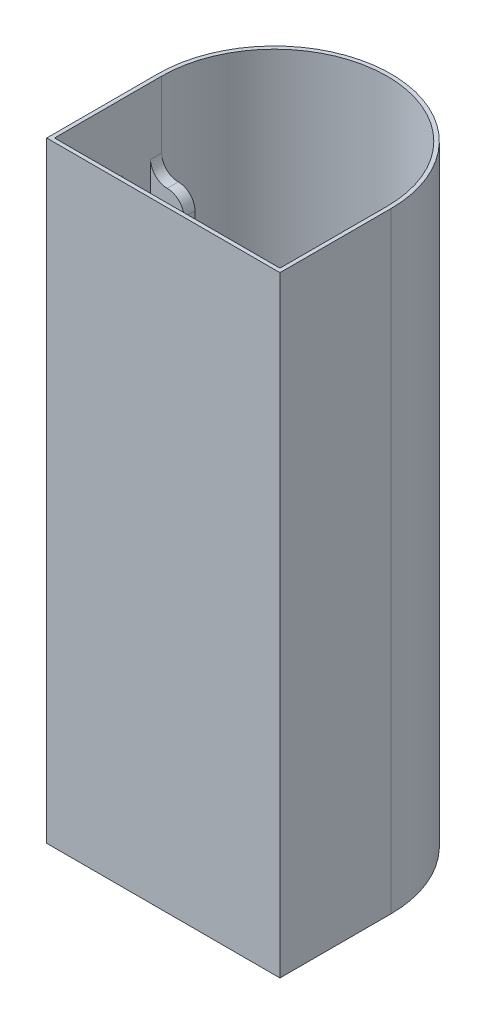
from build123d import *

# Parameters (mm, degrees)
BOSS_EXTRUDE1_DEPTH = 110
CUT_EXTRUDE1_DEPTH  = 109.3
SKETCH3_R           = 3.375
CUT_EXTRUDE2_DEPTH  = 5
SKETCH4_W           = 40.6
SKETCH4_H           = 19.3
CUT_EXTRUDE3_DEPTH  = 15
FILLET1_R           = 3


with BuildPart() as part:
    # Sketch1 → Boss-Extrude1 (new body)
    with BuildSketch(Plane(origin=(0, 0, 0), x_dir=(1, 0, 0), z_dir=(0, 1, 0))):
        with BuildLine():
            Line((-40.883093525, -1.707733813), (1.116906475, -1.707733813))
            Line((1.116906475, -1.707733813), (1.116906475, 18.292266187))
            ThreePointArc((1.116906475, 18.292266187), (-19.883093525, 39.292266187), (-40.883093525, 18.292266187))
            Line((-40.883093525, 18.292266187), (-40.883093525, -1.707733813))
        make_face()
    extrude(amount=BOSS_EXTRUDE1_DEPTH)

    # Sketch2 → Cut-Extrude1 (cut)
    with BuildSketch(Plane(origin=(0, 110, 0), x_dir=(1, 0, 0), z_dir=(0, 1, 0))):
        with BuildLine():
            Line((-40.183093525, 16.292266187), (-40.183093525, 11.292266187))
            Line((-40.183093525, 11.292266187), (-34.183093525, 11.292266187))
            Line((-34.183093525, 11.292266187), (-34.183093525, 9.292266187))
            Line((-34.183093525, 9.292266187), (-40.183093525, 9.292266187))
            Line((-40.183093525, 9.292266187), (-40.183093525, -1.007733813))
            Line((-40.183093525, -1.007733813), (0.416906475, -1.007733813))
            Line((0.416906475, -1.007733813), (0.416906475, 9.292266187))
            Line((0.416906475, 9.292266187), (-5.583093525, 9.292266187))
            Line((-5.583093525, 9.292266187), (-5.583093525, 11.292266187))
            Line((-5.583093525, 11.292266187), (0.416906475, 11.292266187))
            Line((0.416906475, 11.292266187), (0.416906475, 16.292266187))
            Line((0.416906475, 16.292266187), (-5.583093525, 16.292266187))
            Line((-5.583093525, 16.292266187), (-5.583093525, 18.292266187))
            Line((-5.583093525, 18.292266187), (0.416906475, 18.292266187))
            ThreePointArc((0.416906475, 18.292266187), (-19.883093525, 38.592266187), (-40.183093525, 18.292266187))
            Line((-40.183093525, 18.292266187), (-34.183093525, 18.292266187))
            Line((-34.183093525, 18.292266187), (-34.183093525, 16.292266187))
            Line((-34.183093525, 16.292266187), (-40.183093525, 16.292266187))
        make_face()
    extrude(amount=-CUT_EXTRUDE1_DEPTH, mode=Mode.SUBTRACT)

    # Sketch3 → Cut-Extrude2 (cut)
    with BuildSketch(Plane.ZY.offset(40.883093525)):
        with Locations((-4.958932854, 55)):
            Circle(SKETCH3_R)
    extrude(amount=-CUT_EXTRUDE2_DEPTH, mode=Mode.SUBTRACT)

    # Sketch4 → Cut-Extrude3 (cut)
    with BuildSketch(Plane(origin=(0, 110, 0), x_dir=(1, 0, 0), z_dir=(0, 1, 0))):
        with Locations((-19.883093525, 8.642266187)):
            Rectangle(SKETCH4_W, SKETCH4_H)
    extrude(amount=-CUT_EXTRUDE3_DEPTH, mode=Mode.SUBTRACT)

    # Fillet1
    fillet1_edges = [part.edges().sort_by_distance(p)[0] for p in [
        (-40.183093525, 95, -17.292266187),
    ]]
    fillet(fillet1_edges, radius=FILLET1_R)
    fillet1_2_edges = [part.edges().sort_by_distance(p)[0] for p in [
        (-40.183093525, 95, -10.292266187),
    ]]
    fillet(fillet1_2_edges, radius=FILLET1_R)
    fillet1_3_edges = [part.edges().sort_by_distance(p)[0] for p in [
        (0.416906475, 95, -10.292266187),
    ]]
    fillet(fillet1_3_edges, radius=FILLET1_R)
    fillet1_4_edges = [part.edges().sort_by_distance(p)[0] for p in [
        (0.416906475, 95, -17.292266187),
    ]]
    fillet(fillet1_4_edges, radius=FILLET1_R)
    fillet1_5_edges = [part.edges().sort_by_distance(p)[0] for p in [
        (-5.583093525, 95, -17.292266187),
    ]]
    fillet(fillet1_5_edges, radius=FILLET1_R - 0.0001)  # a hair under: the kernel refuses the full size
    fillet1_6_edges = [part.edges().sort_by_distance(p)[0] for p in [
        (-5.583093525, 95, -10.292266187),
    ]]
    fillet(fillet1_6_edges, radius=FILLET1_R - 0.0001)  # a hair under: the kernel refuses the full size
    fillet1_7_edges = [part.edges().sort_by_distance(p)[0] for p in [
        (-34.183093525, 95, -10.292266187),
    ]]
    fillet(fillet1_7_edges, radius=FILLET1_R - 0.0001)  # a hair under: the kernel refuses the full size
    fillet1_8_edges = [part.edges().sort_by_distance(p)[0] for p in [
        (-34.183093525, 95, -17.292266187),
    ]]
    fillet(fillet1_8_edges, radius=FILLET1_R - 0.0001)  # a hair under: the kernel refuses the full size


solid = part.part
